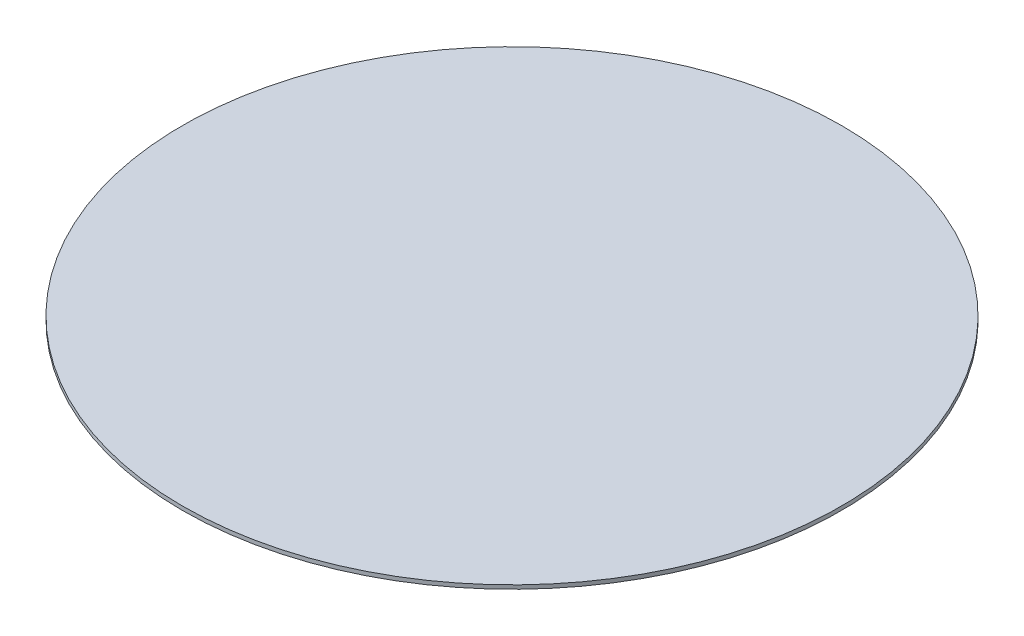
from build123d import *

# Parameters (mm, degrees)
SKETCH1_R           = 10.843749966
BOSS_EXTRUDE1_DEPTH = 0.127


with BuildPart() as part:
    # Sketch1 → Boss-Extrude1 (new body)
    with BuildSketch(Plane(origin=(0, 0, 0), x_dir=(1, 0, 0), z_dir=(0, 1, 0))):
        Circle(SKETCH1_R)
    extrude(amount=BOSS_EXTRUDE1_DEPTH)


solid = part.part
